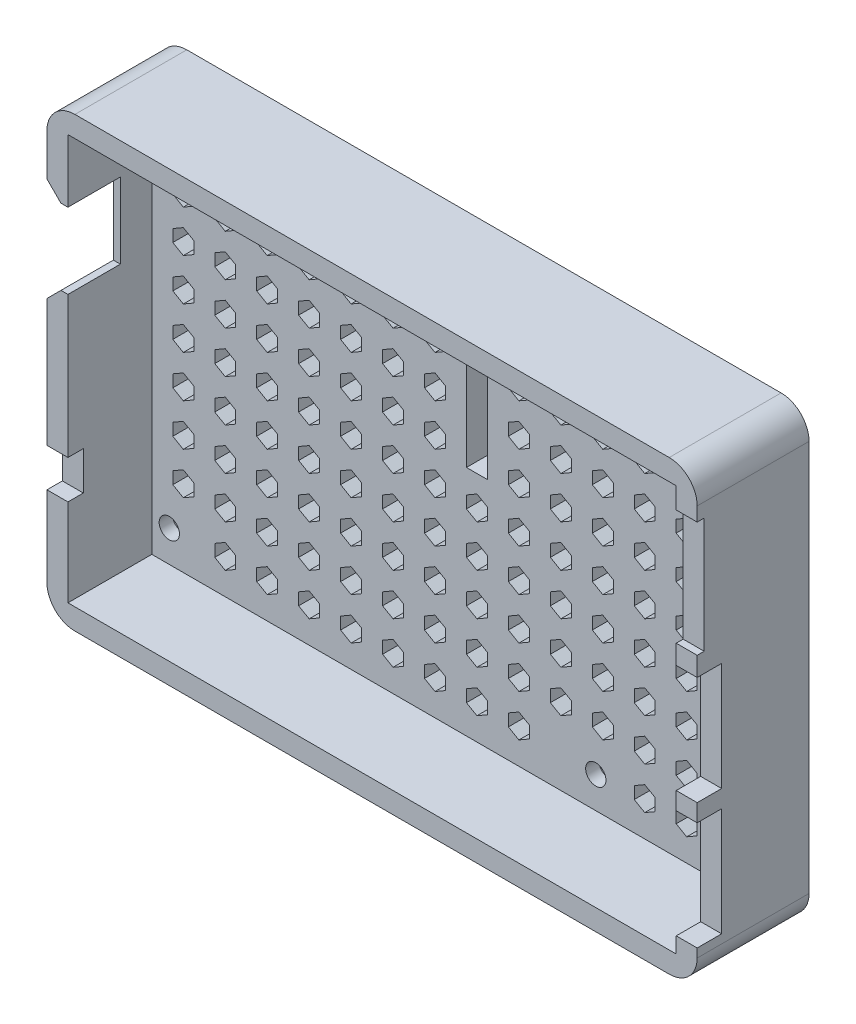
from build123d import *

# Parameters (mm, degrees)
BASE_SKETCH_W                      = 93
BASE_SKETCH_H                      = 64
BASE_DEPTH                         = 16
INSIDE_CUT_SKETCH_W                = 87
INSIDE_CUT_SKETCH_H                = 58
INSIDE_CUT_DEPTH                   = 12
FRONT_CONNECTORS_REACH             = 101.644
FRONT_CONNECTORS_SKETCH_W          = 1
FRONT_CONNECTORS_SKETCH_H          = 16.5
FRONT_CONNECTORS_SKETCH_W_2        = 3.5
FRONT_CONNECTORS_SKETCH_H_2        = 15.5
BACK_CONNECTORS_REACH              = 101.644
BACK_CONNECTORS_SKETCH_W           = 7.5
BACK_CONNECTORS_SKETCH_H           = 10.8
BACK_CONNECTORS_SKETCH_W_2         = 2.2
BACK_CONNECTORS_SKETCH_H_2         = 5.5
MOLEX_ANGLE_SIZE                   = 2
SCREW_HOLES_D                      = 2.9
SCREW_HOLES_CBORE_D                = 6
SCREW_HOLES_CBORE_DEPTH            = 2.1
BOX_ROUNDING_R                     = 4
VENTILATION_HOLE_DEPTH             = 10
VENTILATION_HOLES_ARRAY_COUNT      = 14
VENTILATION_HOLES_ARRAY_PITCH      = 6
VENTILATION_HOLES_ARRAY_COUNT_DIR2 = 9
VENTILATION_HOLES_ARRAY_PITCH_DIR2 = 6
ODEBRAT_VYSUNUT_M1_REACH           = 60.671


with BuildPart() as part:
    # Base sketch → Base (new body)
    with BuildSketch(Plane.XY):
        Rectangle(BASE_SKETCH_W, BASE_SKETCH_H)
    extrude(amount=BASE_DEPTH)

    # Inside cut sketch → Inside cut (cut)
    with BuildSketch(Plane.XY.offset(16)):
        Rectangle(INSIDE_CUT_SKETCH_W, INSIDE_CUT_SKETCH_H)
    extrude(amount=-INSIDE_CUT_DEPTH, mode=Mode.SUBTRACT)

    # Front connectors sketch → Front connectors (cut, up to next)
    with BuildSketch(Plane(origin=(46.5, 0, 0), x_dir=(0, 0, -1), z_dir=(1, 0, 0)), mode=Mode.PRIVATE) as front_connectors_sk1:
        with Locations((-15.5, 17.75)):
            Rectangle(FRONT_CONNECTORS_SKETCH_W, FRONT_CONNECTORS_SKETCH_H)
    front_connectors_tool1 = extrude(front_connectors_sk1.sketch, amount=-FRONT_CONNECTORS_REACH, mode=Mode.PRIVATE) & part.part
    # Front connectors sketch → Front connectors (cut, up to next)
    with BuildSketch(Plane(origin=(46.5, 0, 0), x_dir=(0, 0, -1), z_dir=(1, 0, 0)), mode=Mode.PRIVATE) as front_connectors_sk2:
        with Locations((-14.25, -1)):
            Rectangle(FRONT_CONNECTORS_SKETCH_W_2, FRONT_CONNECTORS_SKETCH_H_2)
    front_connectors_tool2 = extrude(front_connectors_sk2.sketch, amount=-FRONT_CONNECTORS_REACH, mode=Mode.PRIVATE) & part.part
    # Front connectors sketch → Front connectors (cut, up to next)
    with BuildSketch(Plane(origin=(46.5, 0, 0), x_dir=(0, 0, -1), z_dir=(1, 0, 0)), mode=Mode.PRIVATE) as front_connectors_sk3:
        with Locations((-14.25, -19)):
            Rectangle(FRONT_CONNECTORS_SKETCH_W_2, FRONT_CONNECTORS_SKETCH_H_2)
    front_connectors_tool3 = extrude(front_connectors_sk3.sketch, amount=-FRONT_CONNECTORS_REACH, mode=Mode.PRIVATE) & part.part
    add(front_connectors_tool1.solids().sort_by_distance((46.5, 17.75, 15.5))[0], mode=Mode.SUBTRACT)
    add(front_connectors_tool2.solids().sort_by_distance((46.5, -1, 14.25))[0], mode=Mode.SUBTRACT)
    add(front_connectors_tool3.solids().sort_by_distance((46.5, -19, 14.25))[0], mode=Mode.SUBTRACT)

    # Back connectors sketch → Back connectors (cut, up to next)
    with BuildSketch(Plane.ZY.offset(46.5), mode=Mode.PRIVATE) as back_connectors_sk1:
        with Locations((12.25, 14.6)):
            Rectangle(BACK_CONNECTORS_SKETCH_W, BACK_CONNECTORS_SKETCH_H)
    back_connectors_tool1 = extrude(back_connectors_sk1.sketch, amount=-BACK_CONNECTORS_REACH, mode=Mode.PRIVATE) & part.part
    # Back connectors sketch → Back connectors (cut, up to next)
    with BuildSketch(Plane.ZY.offset(46.5), mode=Mode.PRIVATE) as back_connectors_sk2:
        with Locations((14.9, -13.75)):
            Rectangle(BACK_CONNECTORS_SKETCH_W_2, BACK_CONNECTORS_SKETCH_H_2)
    back_connectors_tool2 = extrude(back_connectors_sk2.sketch, amount=-BACK_CONNECTORS_REACH, mode=Mode.PRIVATE) & part.part
    add(back_connectors_tool1.solids().sort_by_distance((-46.5, 14.6, 12.25))[0], mode=Mode.SUBTRACT)
    add(back_connectors_tool2.solids().sort_by_distance((-46.5, -13.75, 14.9))[0], mode=Mode.SUBTRACT)

    # Molex angle
    molex_angle_edges = [part.edges().sort_by_distance(p)[0] for p in [
        (-46.5, 9.2, 12.25),
        (-46.5, 20, 12.25),
        (-46.5, 14.6, 8.5),
    ]]
    chamfer(molex_angle_edges, length=MOLEX_ANGLE_SIZE)

    # Screw holes (through all)
    with Locations(Plane(origin=(0, 0, 0), x_dir=(-1, 0, 0), z_dir=(0, 0, -1))):
        with Locations((-20, -24.5), (-20, 24.5), (41, 24.5), (41, -24.5)):
            CounterBoreHole(SCREW_HOLES_D / 2, SCREW_HOLES_CBORE_D / 2, SCREW_HOLES_CBORE_DEPTH)

    # Box rounding
    box_rounding_edges = [part.edges().sort_by_distance(p)[0] for p in [
        (-46.5, -32, 8),
        (-46.5, 32, 8),
        (46.5, 32, 8),
        (46.5, -32, 8),
    ]]
    fillet(box_rounding_edges, radius=BOX_ROUNDING_R)

    # Ventilation holes sketch → Ventilation hole (cut)
    with BuildSketch(Plane(origin=(0, 0, 0), x_dir=(-1, 0, 0), z_dir=(0, 0, -1))):
        Polygon((-39, 22.265898385), (-37.5, 23.131923789), (-37.5, 24.863974596), (-39, 25.73), (-40.5, 24.863974596), (-40.5, 23.131923789), align=None)
    ventilation_hole = extrude(amount=-VENTILATION_HOLE_DEPTH, mode=Mode.SUBTRACT)

    # Ventilation holes array: Ventilation hole 14 × 9, 10 skipped
    with Locations(*[(-i * VENTILATION_HOLES_ARRAY_PITCH, -j * VENTILATION_HOLES_ARRAY_PITCH_DIR2, 0) for i in range(VENTILATION_HOLES_ARRAY_COUNT) for j in range(VENTILATION_HOLES_ARRAY_COUNT_DIR2) if (i, j) not in ((0, 0), (3, 0), (3, 8), (4, 0), (4, 8), (6, 0), (6, 1), (6, 2), (6, 3), (13, 0), (13, 8))]):
        add(ventilation_hole, mode=Mode.SUBTRACT)

    # Camera cable sketch → Odebrat vysunutím1 (cut, up to next)
    with BuildSketch(Plane(origin=(0, 0, 0), x_dir=(-1, 0, 0), z_dir=(0, 0, -1)), mode=Mode.PRIVATE) as odebrat_vysunut_m1_sk1:
        Polygon((-1.5, 25.765898385), (-4.5, 25.765898385), (-4.5, 4.265898385), (-3, 4.265898385), (-1.5, 4.265898385), align=None)
    odebrat_vysunut_m1_tool1 = extrude(odebrat_vysunut_m1_sk1.sketch, amount=-ODEBRAT_VYSUNUT_M1_REACH, mode=Mode.PRIVATE) & part.part
    add(odebrat_vysunut_m1_tool1.solids().sort_by_distance((3, 15.015898, 0))[0], mode=Mode.SUBTRACT)


solid = part.part
